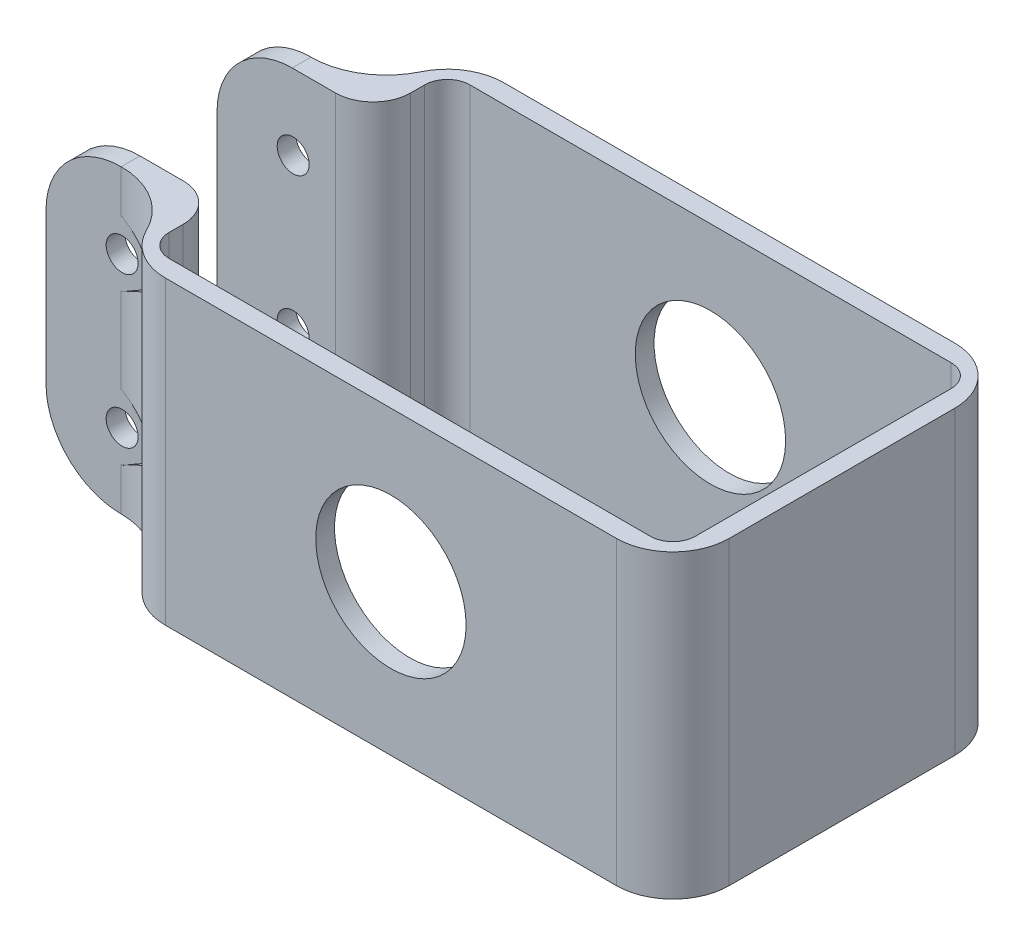
from build123d import *

# Parameters (mm, degrees)
BOSS_EXTRUDE1_DEPTH                 = 20
BOSS_EXTRUDE1_DEPTH_BACK            = 20
FILLET1_R                           = 10
CUT_EXTRUDE1_DEPTH                  = 75.688101624
CUT_EXTRUDE1_DEPTH_BACK             = 75.688101624
CUT_EXTRUDE2_DEPTH                  = 10.375
CUT_EXTRUDE2_DIRECTION_2_REACH      = 76.688
CUT_EXTRUDE2_DIRECTION_2_END_RADIUS = 10
FILLET2_R                           = 10
FILLET3_R                           = 5
CUT_EXTRUDE3_DEPTH                  = 20
CUT_EXTRUDE4_DEPTH                  = 75.384558372
CUT_EXTRUDE4_DEPTH_BACK             = 75.384558372
SKETCH4_R                           = 10


with BuildPart() as part:
    # Sketch1 → Boss-Extrude1 (new, two sides: drawn at the far end of the back side and taken through both)
    with BuildSketch(Plane(origin=(0, 0, 0), x_dir=(1, 0, 0), z_dir=(0, 1, 0)).offset(-BOSS_EXTRUDE1_DEPTH_BACK)):
        with BuildLine():
            Line((-35, -33.125), (-55.75, -33.125))
            Line((-55.75, -33.125), (-55.75, -35.625))
            Line((-55.75, -35.625), (-37.5, -35.625))
            Line((-37.5, -35.625), (-37.5, -38))
            ThreePointArc((-37.5, -38), (-35.303300859, -43.303300859), (-30, -45.5))
            Line((-30, -45.5), (30, -45.5))
            ThreePointArc((30, -45.5), (35.303300859, -43.303300859), (37.5, -38))
            Line((37.5, -38), (37.5, -8))
            ThreePointArc((37.5, -8), (35.303300859, -2.696699141), (30, -0.5))
            Line((30, -0.5), (-30, -0.5))
            ThreePointArc((-30, -0.5), (-35.303300859, -2.696699141), (-37.5, -8))
            Line((-37.5, -8), (-37.5, -10.375))
            Line((-37.5, -10.375), (-55.75, -10.375))
            Line((-55.75, -10.375), (-55.75, -12.875))
            Line((-55.75, -12.875), (-35, -12.875))
            Line((-35, -12.875), (-35, -6))
            ThreePointArc((-35, -6), (-34.121320344, -3.878679656), (-32, -3))
            Line((-32, -3), (32, -3))
            ThreePointArc((32, -3), (34.121320344, -3.878679656), (35, -6))
            Line((35, -6), (35, -40))
            ThreePointArc((35, -40), (34.121320344, -42.121320344), (32, -43))
            Line((32, -43), (-32, -43))
            ThreePointArc((-32, -43), (-34.121320344, -42.121320344), (-35, -40))
            Line((-35, -40), (-35, -33.125))
        make_face()
    extrude(amount=BOSS_EXTRUDE1_DEPTH + BOSS_EXTRUDE1_DEPTH_BACK)

    # Fillet1
    fillet1_edges = [part.edges().sort_by_distance(p)[0] for p in [
        (-37.5, 0, 10.375),
        (-37.5, 0, 35.625),
    ]]
    fillet(fillet1_edges, radius=FILLET1_R)

    # Sketch2 → Cut-Extrude1 (cut, two sides: drawn at the far end of the back side and taken through both)
    with BuildSketch(Plane.XY.offset(-CUT_EXTRUDE1_DEPTH_BACK)):
        with BuildLine():
            ThreePointArc((-43.5, -10), (-44.12239809, -8.49739809), (-45.625, -7.875))
            Line((-45.625, -7.875), (-45.625, -12.125))
            ThreePointArc((-45.625, -12.125), (-44.12239809, -11.50260191), (-43.5, -10))
        make_face()
        with BuildLine():
            Line((-45.625, -12.125), (-45.625, -7.875))
            ThreePointArc((-45.625, -7.875), (-47.75, -10), (-45.625, -12.125))
        make_face()
        with BuildLine():
            ThreePointArc((-43.5, 10), (-44.12239809, 11.50260191), (-45.625, 12.125))
            Line((-45.625, 12.125), (-45.625, 7.875))
            ThreePointArc((-45.625, 7.875), (-44.12239809, 8.49739809), (-43.5, 10))
        make_face()
        with BuildLine():
            Line((-45.625, 7.875), (-45.625, 12.125))
            ThreePointArc((-45.625, 12.125), (-47.75, 10), (-45.625, 7.875))
        make_face()
    extrude(amount=CUT_EXTRUDE1_DEPTH + CUT_EXTRUDE1_DEPTH_BACK, mode=Mode.SUBTRACT)

    # Sketch2<4> → Cut-Extrude2 (cut)
    with BuildSketch(Plane.XY):
        with BuildLine():
            ThreePointArc((-41.375, 10), (-42.61979618, 13.00520382), (-45.625, 14.25))
            Line((-45.625, 14.25), (-45.625, 12.125))
            ThreePointArc((-45.625, 12.125), (-44.12239809, 11.50260191), (-43.5, 10))
            ThreePointArc((-43.5, 10), (-44.12239809, 8.49739809), (-45.625, 7.875))
            Line((-45.625, 7.875), (-45.625, 5.75))
            ThreePointArc((-45.625, 5.75), (-42.61979618, 6.99479618), (-41.375, 10))
        make_face()
        with BuildLine():
            Line((-45.625, 12.125), (-45.625, 14.25))
            ThreePointArc((-45.625, 14.25), (-49.875, 10), (-45.625, 5.75))
            Line((-45.625, 5.75), (-45.625, 7.875))
            ThreePointArc((-45.625, 7.875), (-47.75, 10), (-45.625, 12.125))
        make_face()
        with BuildLine():
            ThreePointArc((-41.375, -10), (-42.61979618, -6.99479618), (-45.625, -5.75))
            Line((-45.625, -5.75), (-45.625, -7.875))
            ThreePointArc((-45.625, -7.875), (-44.12239809, -8.49739809), (-43.5, -10))
            ThreePointArc((-43.5, -10), (-44.12239809, -11.50260191), (-45.625, -12.125))
            Line((-45.625, -12.125), (-45.625, -14.25))
            ThreePointArc((-45.625, -14.25), (-42.61979618, -13.00520382), (-41.375, -10))
        make_face()
        with BuildLine():
            Line((-45.625, -7.875), (-45.625, -5.75))
            ThreePointArc((-45.625, -5.75), (-49.875, -10), (-45.625, -14.25))
            Line((-45.625, -14.25), (-45.625, -12.125))
            ThreePointArc((-45.625, -12.125), (-47.75, -10), (-45.625, -7.875))
        make_face()
    extrude(amount=CUT_EXTRUDE2_DEPTH, mode=Mode.SUBTRACT)

    # Cut-Extrude2 direction 2: up to this cylinder (the profile starts inside it)
    cut_extrude2_direction_2_end = Plane(origin=(-45.751488025, -2.938005, 0.375), z_dir=(0, 1, 0)) * Cylinder(CUT_EXTRUDE2_DIRECTION_2_END_RADIUS, 194.376, mode=Mode.PRIVATE)
    # Sketch2<4> → Cut-Extrude2 direction 2 (cut, up to the surface)
    with BuildSketch(Plane.XY, mode=Mode.PRIVATE) as cut_extrude2_direction_2_sk1:
        with BuildLine():
            ThreePointArc((-41.375, 10), (-42.61979618, 13.00520382), (-45.625, 14.25))
            Line((-45.625, 14.25), (-45.625, 12.125))
            ThreePointArc((-45.625, 12.125), (-44.12239809, 11.50260191), (-43.5, 10))
            ThreePointArc((-43.5, 10), (-44.12239809, 8.49739809), (-45.625, 7.875))
            Line((-45.625, 7.875), (-45.625, 5.75))
            ThreePointArc((-45.625, 5.75), (-42.61979618, 6.99479618), (-41.375, 10))
        make_face()
    cut_extrude2_direction_2_tool1 = extrude(cut_extrude2_direction_2_sk1.sketch, amount=-CUT_EXTRUDE2_DIRECTION_2_REACH, mode=Mode.PRIVATE) & cut_extrude2_direction_2_end
    add(cut_extrude2_direction_2_tool1.solids().sort_by_distance((-42.686995, 7.061995, 0))[0], mode=Mode.SUBTRACT)
    # Sketch2<4> → Cut-Extrude2 direction 2 (cut, up to the surface)
    with BuildSketch(Plane.XY, mode=Mode.PRIVATE) as cut_extrude2_direction_2_sk2:
        with BuildLine():
            Line((-45.625, 12.125), (-45.625, 14.25))
            ThreePointArc((-45.625, 14.25), (-49.875, 10), (-45.625, 5.75))
            Line((-45.625, 5.75), (-45.625, 7.875))
            ThreePointArc((-45.625, 7.875), (-47.75, 10), (-45.625, 12.125))
        make_face()
    cut_extrude2_direction_2_tool2 = extrude(cut_extrude2_direction_2_sk2.sketch, amount=-CUT_EXTRUDE2_DIRECTION_2_REACH, mode=Mode.PRIVATE) & cut_extrude2_direction_2_end
    add(cut_extrude2_direction_2_tool2.solids().sort_by_distance((-45.720033, 6.8125, 0))[0], mode=Mode.SUBTRACT)
    # Sketch2<4> → Cut-Extrude2 direction 2 (cut, up to the surface)
    with BuildSketch(Plane.XY, mode=Mode.PRIVATE) as cut_extrude2_direction_2_sk3:
        with BuildLine():
            ThreePointArc((-41.375, -10), (-42.61979618, -6.99479618), (-45.625, -5.75))
            Line((-45.625, -5.75), (-45.625, -7.875))
            ThreePointArc((-45.625, -7.875), (-44.12239809, -8.49739809), (-43.5, -10))
            ThreePointArc((-43.5, -10), (-44.12239809, -11.50260191), (-45.625, -12.125))
            Line((-45.625, -12.125), (-45.625, -14.25))
            ThreePointArc((-45.625, -14.25), (-42.61979618, -13.00520382), (-41.375, -10))
        make_face()
    cut_extrude2_direction_2_tool3 = extrude(cut_extrude2_direction_2_sk3.sketch, amount=-CUT_EXTRUDE2_DIRECTION_2_REACH, mode=Mode.PRIVATE) & cut_extrude2_direction_2_end
    add(cut_extrude2_direction_2_tool3.solids().sort_by_distance((-42.686995, -12.938005, 0))[0], mode=Mode.SUBTRACT)
    # Sketch2<4> → Cut-Extrude2 direction 2 (cut, up to the surface)
    with BuildSketch(Plane.XY, mode=Mode.PRIVATE) as cut_extrude2_direction_2_sk4:
        with BuildLine():
            Line((-45.625, -7.875), (-45.625, -5.75))
            ThreePointArc((-45.625, -5.75), (-49.875, -10), (-45.625, -14.25))
            Line((-45.625, -14.25), (-45.625, -12.125))
            ThreePointArc((-45.625, -12.125), (-47.75, -10), (-45.625, -7.875))
        make_face()
    cut_extrude2_direction_2_tool4 = extrude(cut_extrude2_direction_2_sk4.sketch, amount=-CUT_EXTRUDE2_DIRECTION_2_REACH, mode=Mode.PRIVATE) & cut_extrude2_direction_2_end
    add(cut_extrude2_direction_2_tool4.solids().sort_by_distance((-49.779967, -10, 0))[0], mode=Mode.SUBTRACT)

    # Fillet2
    # the kernel refuses this fillet: 10 mm, written as the material it takes off along each edge
    with BuildSketch(Plane(origin=(-55.75, 20, -14.625), x_dir=(1, 0, 0), z_dir=(0, 0, 1)), Plane(origin=(-55.75, 20, 8.125), x_dir=(1, 0, 0), z_dir=(0, 0, 1))) as fillet2_piece_1:
        with BuildLine():
            CenterArc((FILLET2_R, -FILLET2_R), FILLET2_R, 90, 90)
            Line((0, -FILLET2_R), (0, 0))
            Line((0, 0), (FILLET2_R, 0))
        make_face()
    extrude(amount=52.5, mode=Mode.SUBTRACT)
    with BuildSketch(Plane(origin=(-55.75, -20, -14.625), x_dir=(1, 0, 0), z_dir=(0, 0, 1)), Plane(origin=(-55.75, -20, 8.125), x_dir=(1, 0, 0), z_dir=(0, 0, 1))) as fillet2_piece_2:
        with BuildLine():
            CenterArc((FILLET2_R, FILLET2_R), FILLET2_R, 180, 90)
            Line((0, FILLET2_R), (0, 0))
            Line((0, 0), (FILLET2_R, 0))
        make_face()
    extrude(amount=52.5, mode=Mode.SUBTRACT)

    # Fillet3
    fillet3_edges = [part.edges().sort_by_distance(p)[0] for p in [
        (-35, 0, 33.125),
        (-35, 0, 12.875),
    ]]
    fillet(fillet3_edges, radius=FILLET3_R)

    # Sketch3 → Cut-Extrude3 (cut)
    with BuildSketch(Plane.XY.offset(35.625)):
        Polygon((-45.625, 14.330127019), (-49.375, 12.165063509), (-49.375, 7.834936491), (-45.625, 5.669872981), (-41.875, 7.834936491), (-41.875, 12.165063509), align=None)
        Polygon((-45.625, -5.669872981), (-49.375, -7.834936491), (-49.375, -12.165063509), (-45.625, -14.330127019), (-41.875, -12.165063509), (-41.875, -7.834936491), align=None)
    extrude(amount=CUT_EXTRUDE3_DEPTH, mode=Mode.SUBTRACT)

    # Sketch4 → Cut-Extrude4 (cut, two sides: drawn at the far end of the back side and taken through both)
    with BuildSketch(Plane.XY.offset(45.5).offset(-CUT_EXTRUDE4_DEPTH_BACK)):
        Circle(SKETCH4_R)
    extrude(amount=CUT_EXTRUDE4_DEPTH + CUT_EXTRUDE4_DEPTH_BACK, mode=Mode.SUBTRACT)


solid = part.part
